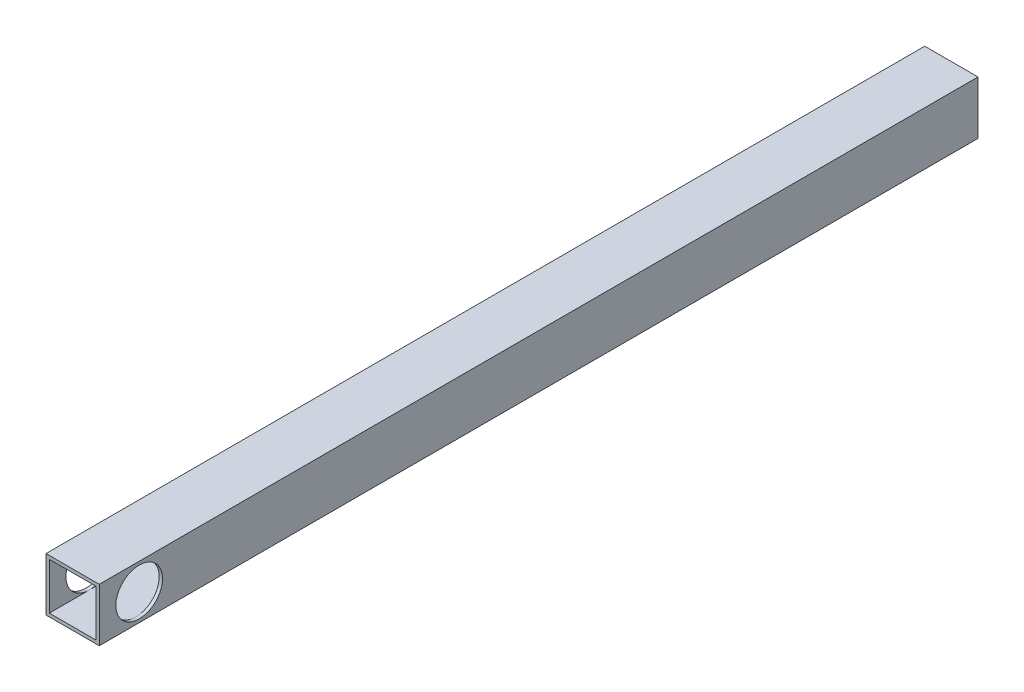
from build123d import *

# Parameters (mm, degrees)
SKETCH1_W           = 25.4
SKETCH1_H           = 25.4
SKETCH1_W_2         = 22.225
SKETCH1_H_2         = 22.225
EXTRUDE_THIN1_DEPTH = 419.1
SKETCH2_R           = 11.1125
CUT_EXTRUDE1_DEPTH  = 421.061019377


with BuildPart() as part:
    # Sketch1 → Extrude-Thin1 (new body)
    with BuildSketch(Plane.XY):
        Rectangle(SKETCH1_W, SKETCH1_H)
        Rectangle(SKETCH1_W_2, SKETCH1_H_2, mode=Mode.SUBTRACT)
    extrude(amount=EXTRUDE_THIN1_DEPTH)

    # Sketch2 → Cut-Extrude1 (cut, through all)
    with BuildSketch(Plane(origin=(12.7, 0, 0), x_dir=(0, 0, -1), z_dir=(1, 0, 0))):
        with Locations((-400.05, 0)):
            Circle(SKETCH2_R)
    extrude(amount=-CUT_EXTRUDE1_DEPTH, mode=Mode.SUBTRACT)


solid = part.part
